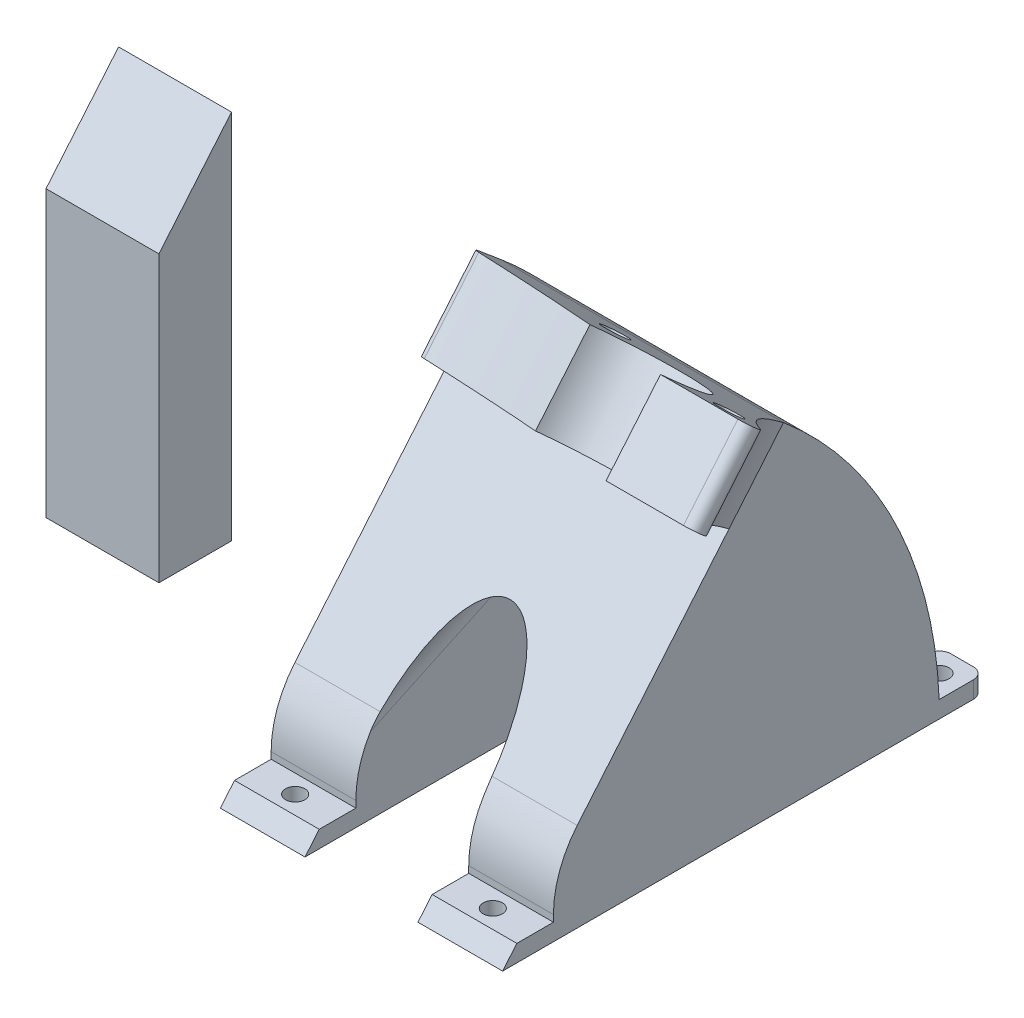
from build123d import *

# Parameters (mm, degrees)
AUFSATZ_LINEAR_AUSTRAGEN1_DEPTH   = 20
AUFSATZ_LINEAR_AUSTRAGEN2_DEPTH   = 20
AUFSATZ_LINEAR_AUSTRAGEN2_2_DEPTH = 20
AUFSATZ_LINEAR_AUSTRAGEN3_DEPTH   = 50
AUFSATZ_LINEAR_AUSTRAGEN4_DEPTH   = 20
SKIZZE5_R                         = 2.2499999999999347
SKIZZE5_R_2                       = 2.2499999999999964
SCHNITT_LINEAR_AUSTRAGEN1_DEPTH   = 154.92337827661623
AUFSATZ_LINEAR_AUSTRAGEN5_DEPTH   = 50
VERRUNDUNG3_R                     = 2
SKIZZE10_R                        = 2.2499999999999964
SCHNITT_LINEAR_AUSTRAGEN2_DEPTH   = 154.9233782766163
SCHNITT_LINEAR_AUSTRAGEN3_DEPTH   = 5
SKIZZE12_W                        = 19.999999999999993
SKIZZE12_H                        = 50
SKIZZE12_W_2                      = 20.000000000000014
SCHNITT_LINEAR_AUSTRAGEN4_DEPTH   = 163.42500642504442
VERRUNDUNG5_R                     = 10
VERRUNDUNG6_R                     = 10
SKIZZE13_R                        = 1.6999999999999995
SKIZZE13_R_2                      = 1.700000000000026
AUFSATZ_LINEAR_AUSTRAGEN9_DEPTH   = 3
VERRUNDUNG7_R                     = 2
VERRUNDUNG8_R                     = 2
SCHNITT_LINEAR_AUSTRAGEN5_DEPTH   = 156.1930410648953
VERRUNDUNG9_R                     = 18
SKIZZE15_R                        = 1.6999999999999995
SCHNITT_LINEAR_AUSTRAGEN6_DEPTH   = 156.1930410648953
VERRUNDUNG10_R                    = 2
SKIZZE18_W                        = 119.99999999999997
SKIZZE18_H                        = 10.2
SCHNITT_LINEAR_AUSTRAGEN8_DEPTH   = 10
VERRUNDUNG12_R                    = 18
VERRUNDUNG13_R                    = 2
SKIZZE16_R                        = 102.01235542308495
SCHNITT_LINEAR_AUSTRAGEN7_DEPTH   = 189.02894525437085
SKIZZE19_R                        = 1.5000000000000009
SKIZZE19_R_2                      = 1.5000000000000007
SCHNITT_LINEAR_AUSTRAGEN9_DEPTH   = 10
SKIZZE20_R                        = 2.4999999999999987
SKIZZE20_R_2                      = 1.5000000000000007
SKIZZE20_R_3                      = 1.5000000000000009
AUFSATZ_LINEAR_AUSTRAGEN11_DEPTH  = 2
FASE1_SIZE                        = 2
SKIZZE21_R                        = 1.4999999999999973
SCHNITT_LINEAR_AUSTRAGEN12_DEPTH  = 10
SKIZZE22_R                        = 1.4999999999999971
SCHNITT_LINEAR_AUSTRAGEN13_DEPTH  = 10


with BuildPart() as part:
    # Skizze1 → Aufsatz-Linear austragen1 (new body)
    with BuildSketch(Plane(origin=(0, 0, 0), x_dir=(0, 0, -1), z_dir=(1, 0, 0))):
        Polygon((0, 0), (-1.209e-14, 65.78044443118975), (-12.855752193730883, 50.45955556881026), (-12.855752193730876, -2.36e-15), align=None)
    extrude(amount=AUFSATZ_LINEAR_AUSTRAGEN1_DEPTH)


with BuildPart() as body_2:
    # Skizze2 → Aufsatz-Linear austragen2 (new body)
    with BuildSketch(Plane(origin=(0, 38.60154936639293, -32.390545836212254), x_dir=(-1, 0, 0), z_dir=(0, 0.7660444431189743, -0.6427876096865437))):
        with BuildLine():
            Line((89.99999999999999, 60.58092012780532), (90, 32.15785464004299))
            Line((90, 32.15785464004299), (40, 32.157854640043))
            Line((40, 32.157854640043), (39.99999999999999, 38.85026313842354))
            ThreePointArc((39.99999999999999, 38.85026313842354), (65.782949027453, 47.914106689894396), (89.99999999999999, 60.58092012780532))
        make_face()
    extrude(amount=-AUFSATZ_LINEAR_AUSTRAGEN2_DEPTH)

    # Skizze4 → Aufsatz-Linear austragen3 (add)
    with BuildSketch(Plane.ZY.offset(90.00000000000001)):
        with BuildLine():
            ThreePointArc((-7.756199986579628, 59.27221988311346), (-28.14591240579339, 32.699829313458416), (-35.39529003392221, -6.94e-15))
            Line((-35.39529003392221, -6.94e-15), (41.979097856400095, -6.94e-15))
            Line((41.979097856400095, -6.94e-15), (5.099552207151247, 43.951331020733974))
            Line((5.099552207151247, 43.951331020733974), (-7.756199986579628, 59.27221988311346))
        make_face()
    extrude(amount=-AUFSATZ_LINEAR_AUSTRAGEN3_DEPTH)



with BuildPart() as body_3:
    # Skizze2 → Aufsatz-Linear austragen2 2 (new body)
    with BuildSketch(Plane(origin=(0, 38.60154936639293, -32.390545836212254), x_dir=(-1, 0, 0), z_dir=(0, 0.7660444431189743, -0.6427876096865437))):
        with BuildLine():
            Line((-109.99999999999997, 60.58092012780532), (-109.99999999999999, 32.15785464004299))
            Line((-109.99999999999999, 32.15785464004299), (-60.00000000000001, 32.157854640043))
            Line((-60.00000000000001, 32.157854640043), (-60, 38.85026313842354))
            ThreePointArc((-60, 38.85026313842354), (-85.78294902745297, 47.91410668989437), (-109.99999999999997, 60.58092012780532))
        make_face()
    extrude(amount=-AUFSATZ_LINEAR_AUSTRAGEN2_2_DEPTH)


with BuildPart() as body_2_1:
    add(body_2.part)

    add(body_3.part)  # Aufsatz-Linear austragen4 merges body 3
    # Skizze6 → Aufsatz-Linear austragen4 (add)
    with BuildSketch(Plane(origin=(0, 38.601549366392966, -32.39054583621228), x_dir=(1, 0, 0), z_dir=(0, 0.7660444431189745, -0.6427876096865438))):
        with BuildLine():
            ThreePointArc((-90, -32.15785464004299), (-97.30849227277704, -47.841026986521875), (-109.01622804444871, -60.58092012780532))
            Line((-109.01622804444871, -60.58092012780532), (-89.99999999999996, -60.58092012780531))
            Line((-89.99999999999996, -60.58092012780531), (-90, -32.15785464004299))
        make_face()
        with BuildLine():
            ThreePointArc((110.00000000000001, -32.157854640043034), (117.30849227277703, -47.84102698652191), (129.01622804444872, -60.580920127805356))
            Line((129.01622804444872, -60.580920127805356), (110, -60.580920127805335))
            Line((110, -60.580920127805335), (110.00000000000001, -32.157854640043034))
        make_face()
    extrude(amount=-AUFSATZ_LINEAR_AUSTRAGEN4_DEPTH)

    # Skizze5 → Schnitt-Linear austragen1 (cut, through all)
    with BuildSketch(Plane(origin=(0, 38.601549366392966, -32.39054583621228), x_dir=(1, 0, 0), z_dir=(0, 0.7660444431189745, -0.6427876096865438))):
        with Locations(Location((-67.93678140390588, -39.2901785012674, 0), (0, 0, 270))):
            Circle(SKIZZE5_R)
        with BuildLine():
            ThreePointArc((-68.8427839392676, -49.276117644901774), (-85.25507840084563, -44.01063116187818), (-90, -60.58092012780534))
            ThreePointArc((-89.99999999999999, -60.58092012780534), (-79.59986038817945, -54.59451084889355), (-68.84278393926756, -49.2761176449018))
        make_face()
        with Locations(Location((-98.80470560431883, -55.787792133473864, 0), (0, 0, 270))):
            Circle(SKIZZE5_R_2)
        with BuildLine():
            ThreePointArc((110.00000000000003, -60.580920127805335), (93.94464237551333, -65.17839053590887), (88.84278393926762, -49.27611764490177))
            ThreePointArc((88.84278393926762, -49.27611764490177), (105.25507840084566, -44.01063116187818), (110.00000000000003, -60.580920127805335))
        make_face()
    extrude(amount=-SCHNITT_LINEAR_AUSTRAGEN1_DEPTH, mode=Mode.SUBTRACT)

    # Skizze7 → Aufsatz-Linear austragen5 (add)
    with BuildSketch(Plane(origin=(60.00000000000004, 3.999e-14, 4.766e-14), x_dir=(7.9e-16, 0, -1), z_dir=(1, 6.7e-16, 7.9e-16))):
        with BuildLine():
            Line((7.756199986579595, 59.272219883113486), (-41.979097856400124, 1.817e-14))
            Line((-41.979097856400124, 1.817e-14), (35.39529003392218, 1.817e-14))
            ThreePointArc((35.39529003392218, 1.817e-14), (28.145912405793332, 32.69982931345845), (7.756199986579595, 59.272219883113486))
        make_face()
    extrude(amount=AUFSATZ_LINEAR_AUSTRAGEN5_DEPTH)

    # Verrundung3
    verrundung3_edges = [body_2_1.edges().sort_by_distance(p)[0] for p in [
        (-109.01622804444871, 69.88176977676663, 20.445007483592853),
    ]]
    fillet(verrundung3_edges, radius=VERRUNDUNG3_R)

    # Skizze10 → Schnitt-Linear austragen2 (cut, through all)
    with BuildSketch(Plane(origin=(0, 38.601549366392966, -32.39054583621228), x_dir=(1, 0, 0), z_dir=(0, 0.7660444431189745, -0.6427876096865438))):
        with Locations(Location((86.34802459849006, -40.15329039482156, 0), (0, 0, 270))):
            Circle(SKIZZE10_R)
        with Locations(Location((119.09894185825529, -56.58092012780534, 0), (0, 0, 270))):
            Circle(SKIZZE10_R)
    extrude(amount=-SCHNITT_LINEAR_AUSTRAGEN2_DEPTH, mode=Mode.SUBTRACT)

    # Skizze11 → Schnitt-Linear austragen3 (cut)
    with BuildSketch(Plane(origin=(0, 23.28066050401348, -19.534793642481407), x_dir=(1, 0, 0), z_dir=(0, -0.7660444431189745, 0.6427876096865438))):
        Polygon((60.00000000000001, 32.15785464004304), (109.99999999999999, 32.1578546400431), (141.02821228777057, 65.90002397102104), (38.34357710817464, 62.992820090396236), align=None)
    extrude(amount=-SCHNITT_LINEAR_AUSTRAGEN3_DEPTH, mode=Mode.SUBTRACT)

    # Skizze12 → Schnitt-Linear austragen4 (cut, through all)
    with BuildSketch(Plane(origin=(-8.12e-15, 16.620901993437233, -35.64363935003694), x_dir=(-1, 3.1e-16, 3.7e-16), z_dir=(0, 0.4226182617407026, -0.9063077870366486))):
        with Locations((65, 10.041304052055779)):
            Rectangle(SKIZZE12_W, SKIZZE12_H)
        with Locations((-85.00000000000011, 10.041304052055779)):
            Rectangle(SKIZZE12_W_2, SKIZZE12_H)
    extrude(amount=-SCHNITT_LINEAR_AUSTRAGEN4_DEPTH, mode=Mode.SUBTRACT)

    # Verrundung5
    verrundung5_edges = [body_2_1.edges().sort_by_distance(p)[0] for p in [
        (75.0000000000001, 39.4549061743576, -1.6965302152626833),
        (95.0000000000001, 39.45490617435759, -1.696530215262662),
    ]]
    fillet(verrundung5_edges, radius=VERRUNDUNG5_R - 0.0001)  # a hair under: the kernel refuses the full size

    # Verrundung6
    verrundung6_edges = [body_2_1.edges().sort_by_distance(p)[0] for p in [
        (-54.999999999999986, 39.45490617435774, -1.6965302152628254),
        (-75, 39.454906174357745, -1.6965302152628183),
    ]]
    fillet(verrundung6_edges, radius=VERRUNDUNG6_R - 0.0001)  # a hair under: the kernel refuses the full size

    # Skizze13 → Aufsatz-Linear austragen9 (add)
    # profile 1 of 4: a face of its own
    with BuildSketch(Plane(origin=(0, 0, 0), x_dir=(1, 0, 0), z_dir=(0, 1, 0))):
        Polygon((-40.00000000000001, 35.395290033922194), (-40, 43.39529003392219), (-48, 43.39529003392219), (-48, 35.395290033922194), (-48, 33.39585128291134), (-40.00000000000001, 33.39585128291134), align=None)
        with Locations(Location((-44, 39.395290033922194, 0), (0, 0, 270))):
            Circle(SKIZZE13_R, mode=Mode.SUBTRACT)
    # profile 2 of 4: a face of its own
    with BuildSketch(Plane(origin=(0, 0, 0), x_dir=(1, 0, 0), z_dir=(0, 1, 0))):
        Polygon((-90.00000000000003, 43.39529003392219), (-82.00000000000003, 43.39529003392219), (-82.00000000000003, 35.395290033922194), (-82.00000000000003, 33.39585128291134), (-90.00000000000003, 33.39585128291134), (-90.00000000000003, 35.395290033922194), align=None)
        with Locations(Location((-86.00000000000003, 39.395290033922194, 0), (0, 0, 90))):
            Circle(SKIZZE13_R, mode=Mode.SUBTRACT)
    # profile 3 of 4: a face of its own
    with BuildSketch(Plane(origin=(0, 0, 0), x_dir=(1, 0, 0), z_dir=(0, 1, 0))):
        Polygon((68.00000000000006, 33.39585128291134), (68.00000000000006, 35.395290033922194), (68.00000000000006, 43.39529003392219), (60.00000000000006, 43.39529003392219), (60.000000000000064, 35.39529003392213), (60.000000000000064, 33.39585128291134), align=None)
        with Locations(Location((64.00000000000006, 39.395290033922194, 0), (0, 0, 90))):
            Circle(SKIZZE13_R, mode=Mode.SUBTRACT)
    # profile 4 of 4: a face of its own
    with BuildSketch(Plane(origin=(0, 0, 0), x_dir=(1, 0, 0), z_dir=(0, 1, 0))):
        Polygon((110.0000000000001, 33.39585128291134), (102.00000000000007, 33.39585128291134), (102.00000000000007, 35.395290033922194), (102.00000000000007, 43.39529003392219), (110.0000000000001, 43.39529003392219), (110.0000000000001, 35.395290033922194), align=None)
        with Locations(Location((106.00000000000009, 39.395290033922194, 0), (0, 0, 270))):
            Circle(SKIZZE13_R_2, mode=Mode.SUBTRACT)
    extrude(amount=AUFSATZ_LINEAR_AUSTRAGEN9_DEPTH)

    # Verrundung7
    verrundung7_edges = [body_2_1.edges().sort_by_distance(p)[0] for p in [
        (-40, 1.5, -43.39529003392219),
        (-48, 1.5, -43.39529003392219),
        (-90.00000000000003, 1.5, -43.39529003392219),
        (-82.00000000000003, 1.5, -43.39529003392219),
    ]]
    fillet(verrundung7_edges, radius=VERRUNDUNG7_R)

    # Verrundung8
    verrundung8_edges = [body_2_1.edges().sort_by_distance(p)[0] for p in [
        (60.00000000000006, 1.5, -43.39529003392219),
        (68.00000000000006, 1.5, -43.39529003392219),
        (102.00000000000007, 1.5, -43.39529003392219),
        (110.0000000000001, 1.5, -43.39529003392219),
    ]]
    fillet(verrundung8_edges, radius=VERRUNDUNG8_R)

    # Skizze14 → Schnitt-Linear austragen5 (cut, through all)
    with BuildSketch(Plane(origin=(9.4e-16, 2.9999999999999933, 0), x_dir=(-1, 3.1e-16, 0), z_dir=(-3.1e-16, -1, 0))):
        Polygon((90.00000000000001, -32.97909785640016), (74.99999999999999, -32.97909785640016), (74.99999999999999, -41.9790978564003), (89.99999999999999, -41.97909785640014), align=None)
        Polygon((39.99999999999998, -41.97909785640012), (39.999999999999936, -32.97909785640016), (54.999999999999964, -32.97909785640016), (54.999999999999986, -41.9790978564003), align=None)
        Polygon((-59.99999999999996, -32.97909785640016), (-74.99999999999999, -32.97909785640016), (-75.00000000000001, -41.9790978564003), (-60.00000000000001, -41.97909785640017), align=None)
        Polygon((-110, -41.97909785640014), (-110.00000000000003, -32.97909785640016), (-95, -32.97909785640016), (-95, -41.9790978564003), align=None)
    extrude(amount=-SCHNITT_LINEAR_AUSTRAGEN5_DEPTH, mode=Mode.SUBTRACT)

    # Verrundung9
    verrundung9_edges = [body_2_1.edges().sort_by_distance(p)[0] for p in [
        (-47.49999999999998, 10.725782333347722, 32.97909785640016),
        (-82.49999999999999, 10.72578233334775, 32.97909785640016),
    ]]
    fillet(verrundung9_edges, radius=VERRUNDUNG9_R)

    # Skizze15 → Schnitt-Linear austragen6 (cut, through all)
    with BuildSketch(Plane(origin=(9.4e-16, 2.9999999999999933, 0), x_dir=(-1, 3.1e-16, 0), z_dir=(-3.1e-16, -1, 0))):
        with Locations(Location((82.49999999999999, -36.22044840963421, 0), (0, 0, 180))):
            Circle(SKIZZE15_R)
        with Locations((47.499999999999986, -36.22044840963421)):
            Circle(SKIZZE15_R)
        with Locations((-102.50000000000001, -36.22044840963421)):
            Circle(SKIZZE15_R)
        with Locations(Location((-67.5, -36.22044840963421, 0), (0, 0, 180))):
            Circle(SKIZZE15_R)
    extrude(amount=SCHNITT_LINEAR_AUSTRAGEN6_DEPTH, mode=Mode.SUBTRACT)

    # Verrundung10
    verrundung10_edges = [body_2_1.edges().sort_by_distance(p)[0] for p in [
        (129.01622804444872, 71.79688088456409, 18.838038459376516),
        (60.00000000000001, 57.828683821441146, 2.1913894273360848),
    ]]
    fillet(verrundung10_edges, radius=VERRUNDUNG10_R)

    # Skizze18 → Schnitt-Linear austragen8 (cut)
    with BuildSketch(Plane(origin=(0, 38.601549366392945, -32.39054583621226), x_dir=(1, 0, 0), z_dir=(0, 0.7660444431189745, -0.6427876096865438))):
        with Locations((10.000000000000039, -17.05785464004297)):
            Rectangle(SKIZZE18_W, SKIZZE18_H)
    extrude(amount=-SCHNITT_LINEAR_AUSTRAGEN8_DEPTH, mode=Mode.SUBTRACT)

    # Verrundung12
    verrundung12_edges = [body_2_1.edges().sort_by_distance(p)[0] for p in [
        (102.5, 10.725782333347924, 32.97909785640016),
        (67.5, 10.725782333347862, 32.97909785640016),
    ]]
    fillet(verrundung12_edges, radius=VERRUNDUNG12_R)

    # Verrundung13
    verrundung13_edges = [body_2_1.edges().sort_by_distance(p)[0] for p in [
        (-39.999999999999986, 55.91357271364369, 3.7983584515524607),
    ]]
    fillet(verrundung13_edges, radius=VERRUNDUNG13_R)

    # Skizze16 → Schnitt-Linear austragen7 (cut, through all)
    with BuildSketch(Plane(origin=(-40.000000000000036, 2.666e-14, 3.177e-14), x_dir=(-7.9e-16, 0, -1), z_dir=(1, -6.7e-16, -7.9e-16))):
        with Locations((7.488259970443778, 22.25050331384182)):
            Circle(SKIZZE16_R)
    extrude(amount=-SCHNITT_LINEAR_AUSTRAGEN7_DEPTH, mode=Mode.SUBTRACT)

    # Skizze19 → Schnitt-Linear austragen9 (cut)
    with BuildSketch(Plane.ZY.offset(-60.00000000000004)):
        with Locations((-22.394187380356886, 34.29602854135633)):
            Circle(SKIZZE19_R)
        with Locations((-22.394187380356886, 3.296028541356328)):
            Circle(SKIZZE19_R_2)
    extrude(amount=-SCHNITT_LINEAR_AUSTRAGEN9_DEPTH, mode=Mode.SUBTRACT)

    # Skizze20 → Aufsatz-Linear austragen11 (add)
    # profile 1 of 3: a face of its own
    with BuildSketch(Plane.ZY.offset(-60.00000000000004)):
        Polygon((-24.894187380356882, 1.819e-14), (-19.894187380356886, 1.819e-14), (-18.594187380356885, 1.833e-14), (-18.594187380356885, 6.592057082712639), (-19.894187380356886, 6.592057082712637), (-24.894187380356882, 6.592057082712637), (-26.194187380356883, 6.592057082712638), (-26.194187380356883, 1.74e-14), align=None)
        with Locations((-22.394187380356886, 3.2960285413563275)):
            Circle(SKIZZE20_R, mode=Mode.SUBTRACT)
    # profile 2 of 3: a face of its own
    with BuildSketch(Plane.ZY.offset(-60.00000000000004)):
        with Locations((-22.394187380356886, 3.2960285413563275)):
            Circle(SKIZZE20_R)
        with Locations((-22.394187380356886, 3.296028541356328)):
            Circle(SKIZZE20_R_2, mode=Mode.SUBTRACT)
    # profile 3 of 3: a face of its own
    with BuildSketch(Plane.ZY.offset(-60.00000000000004)):
        with BuildLine():
            Line((-26.194187380356883, 36.595069086283004), (-26.194187380356883, 30.496028541356324))
            Line((-26.194187380356883, 30.496028541356324), (-18.594187380356882, 30.496028541356324))
            Line((-18.594187380356882, 30.496028541356324), (-18.594187380356882, 38.09602854135633))
            Line((-18.594187380356882, 38.09602854135633), (-25.36693774168257, 38.096028541356326))
            ThreePointArc((-25.36693774168257, 38.09602854135633), (-25.78471844481995, 37.34783931764406), (-26.194187380356887, 36.595069086283004))
        make_face()
        with Locations((-22.394187380356886, 34.29602854135633)):
            Circle(SKIZZE20_R_3, mode=Mode.SUBTRACT)
    extrude(amount=AUFSATZ_LINEAR_AUSTRAGEN11_DEPTH)

    # Fase1
    fase1_edges = [body_2_1.edges().sort_by_distance(p)[0] for p in [
        (60.00000000000006, 3.2960285413563684, -18.59418738035684),
        (60.000000000000064, 3.296028541356368, -26.194187380356837),
        (60.00000000000006, 6.592057082712678, -22.39418738035684),
        (60.000000000000036, 34.29602854135637, -18.594187380356836),
        (60.00000000000004, 33.54554881381971, -26.194187380356837),
        (60.00000000000004, 30.496028541356363, -22.394187380356836),
    ]]
    chamfer(fase1_edges, length=FASE1_SIZE - 0.0001)  # a hair under: the kernel refuses the full size

    # Skizze21 → Schnitt-Linear austragen12 (cut)
    with BuildSketch(Plane(origin=(1.162e-14, 24.542302710435624, -35.22438658297153), x_dir=(-1, 1.5e-16, -2.2e-16), z_dir=(0, 0.5716668063955725, -0.820485869753701))):
        with Locations(Location((-67.50000000000006, 20.376936816014638, 0), (0, 0, 90))):
            Circle(SKIZZE21_R)
    extrude(amount=-SCHNITT_LINEAR_AUSTRAGEN12_DEPTH, mode=Mode.SUBTRACT)

    # Skizze22 → Schnitt-Linear austragen13 (cut)
    with BuildSketch(Plane(origin=(2.72e-14, 1.3735884689018287, -35.40021690632274), x_dir=(-1, 3e-17, -7.7e-16), z_dir=(0, 0.03877251997459974, -0.9992480631428913))):
        with Locations(Location((-67.50000000000006, 4.627635410153003, 0), (0, 0, 90))):
            Circle(SKIZZE22_R)
    extrude(amount=-SCHNITT_LINEAR_AUSTRAGEN13_DEPTH, mode=Mode.SUBTRACT)


solid = Compound([part.part, body_2_1.part])
